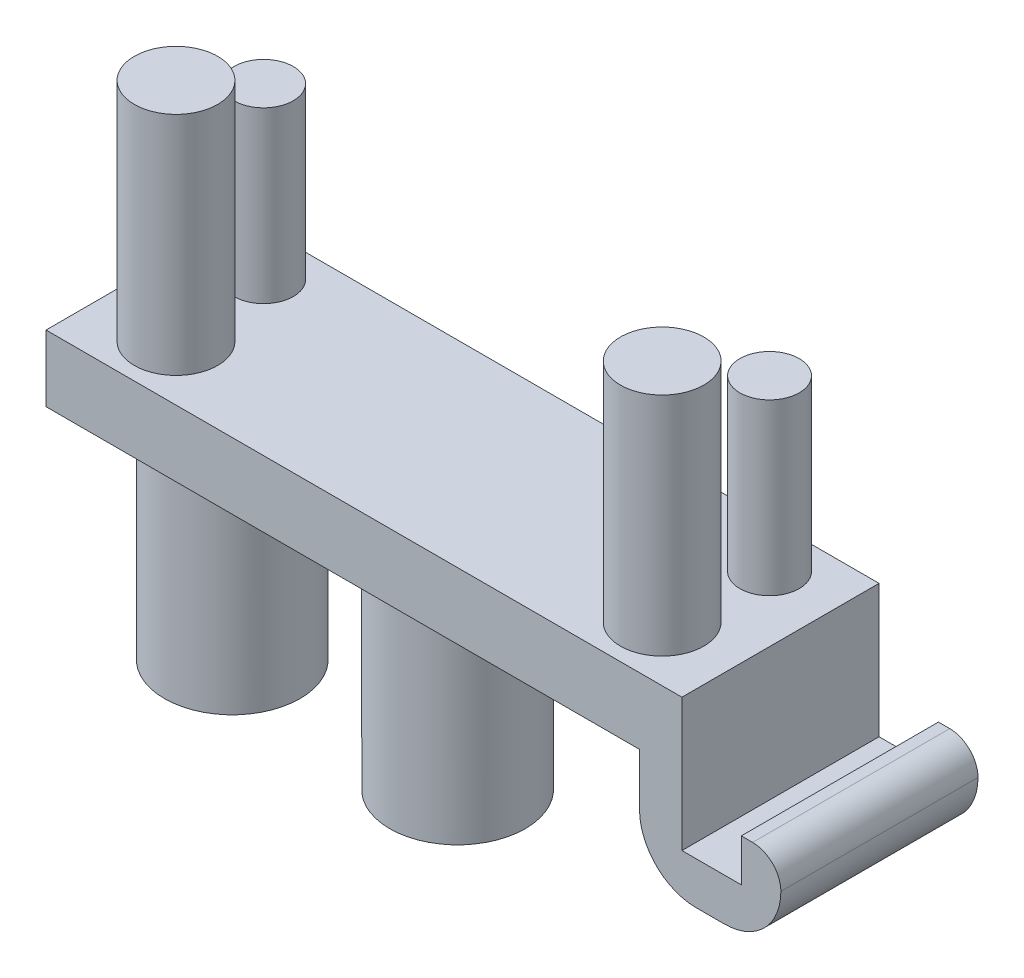
from build123d import *

# Parameters (mm, degrees)
SKETCH1_W           = 22.5
SKETCH1_H           = 6.975
BOSS_EXTRUDE1_DEPTH = 2.35
SKETCH2_R           = 1.475
BOSS_EXTRUDE2_DEPTH = 8
SKETCH3_W           = 1.5
SKETCH3_H           = 6.975
BOSS_EXTRUDE3_DEPTH = 3.85
SKETCH4_W           = 6.975
SKETCH4_H           = 3
BOSS_EXTRUDE4_DEPTH = 3.5
SKETCH5_W           = 2.1
SKETCH5_H           = 6.975
CUT_EXTRUDE1_DEPTH  = 1.5
SKETCH6_R           = 1.05
BOSS_EXTRUDE5_DEPTH = 6
SKETCH7_R           = 2.4
BOSS_EXTRUDE9_DEPTH = 7.76
FILLET1_R           = 2
FILLET2_R           = 2
FILLET3_R           = 1


with BuildPart() as part:
    # Sketch1 → Boss-Extrude1 (new body)
    with BuildSketch(Plane(origin=(0, 0, 0), x_dir=(1, 0, 0), z_dir=(0, 1, 0))):
        with Locations((-16.71505467, -8.920455339)):
            Rectangle(SKETCH1_W, SKETCH1_H)
    extrude(amount=BOSS_EXTRUDE1_DEPTH)

    # Sketch2 → Boss-Extrude2 (add)
    with BuildSketch(Plane(origin=(0, 2.35, 0), x_dir=(1, 0, 0), z_dir=(0, 1, 0))):
        with Locations(Location((-25.31505467, -10.457955339, 0), (0, 0, 270))):
            Circle(SKETCH2_R)
        with Locations(Location((-8.11505467, -10.457955339, 0), (0, 0, 270))):
            Circle(SKETCH2_R)
    extrude(amount=BOSS_EXTRUDE2_DEPTH)

    # Sketch3 → Boss-Extrude3 (add)
    with BuildSketch(Plane(origin=(0, 0, 0), x_dir=(-1, 0, 0), z_dir=(0, -1, 0))):
        with Locations((6.21505467, -8.920455339)):
            Rectangle(SKETCH3_W, SKETCH3_H)
    extrude(amount=BOSS_EXTRUDE3_DEPTH)

    # Sketch4 → Boss-Extrude4 (add)
    with BuildSketch(Plane(origin=(-5.46505467, 0, 0), x_dir=(0, 0, -1), z_dir=(1, 0, 0))):
        with Locations((-8.920455339, -2.35)):
            Rectangle(SKETCH4_W, SKETCH4_H)
    extrude(amount=BOSS_EXTRUDE4_DEPTH)

    # Sketch5 → Cut-Extrude1 (cut)
    with BuildSketch(Plane(origin=(0, -0.85, 0), x_dir=(1, 0, 0), z_dir=(0, 1, 0))):
        with Locations((-4.41505467, -8.920455339)):
            Rectangle(SKETCH5_W, SKETCH5_H)
    extrude(amount=-CUT_EXTRUDE1_DEPTH, mode=Mode.SUBTRACT)

    # Sketch6 → Boss-Extrude5 (add)
    with BuildSketch(Plane(origin=(0, 2.35, 0), x_dir=(1, 0, 0), z_dir=(0, 1, 0))):
        with Locations(Location((-7.76505467, -7.007955339, 0), (0, 0, 270))):
            Circle(SKETCH6_R)
        with Locations(Location((-25.66505467, -7.007955339, 0), (0, 0, 270))):
            Circle(SKETCH6_R)
    extrude(amount=BOSS_EXTRUDE5_DEPTH)

    # Sketch7 → Boss-Extrude9 (add)
    with BuildSketch(Plane(origin=(0, 0, 0), x_dir=(-1, 0, 0), z_dir=(0, -1, 0))):
        with Locations(Location((16.71505467, -9.097955339, 0), (0, 0, 270))):
            Circle(SKETCH7_R)
        with Locations(Location((24.68505467, -9.097955339, 0), (0, 0, 270))):
            Circle(SKETCH7_R)
    extrude(amount=BOSS_EXTRUDE9_DEPTH)

    # Fillet1
    fillet1_edges = [part.edges().sort_by_distance(p)[0] for p in [
        (-6.96505467, -3.85, 8.920455339),
    ]]
    fillet(fillet1_edges, radius=FILLET1_R)

    # Fillet2
    fillet2_edges = [part.edges().sort_by_distance(p)[0] for p in [
        (-1.96505467, -3.85, 8.920455339),
    ]]
    fillet(fillet2_edges, radius=FILLET2_R)

    # Fillet3
    fillet3_edges = [part.edges().sort_by_distance(p)[0] for p in [
        (-1.96505467, -0.85, 8.920455339),
    ]]
    fillet(fillet3_edges, radius=FILLET3_R - 0.0001)  # a hair under: the kernel refuses the full size


solid = part.part
